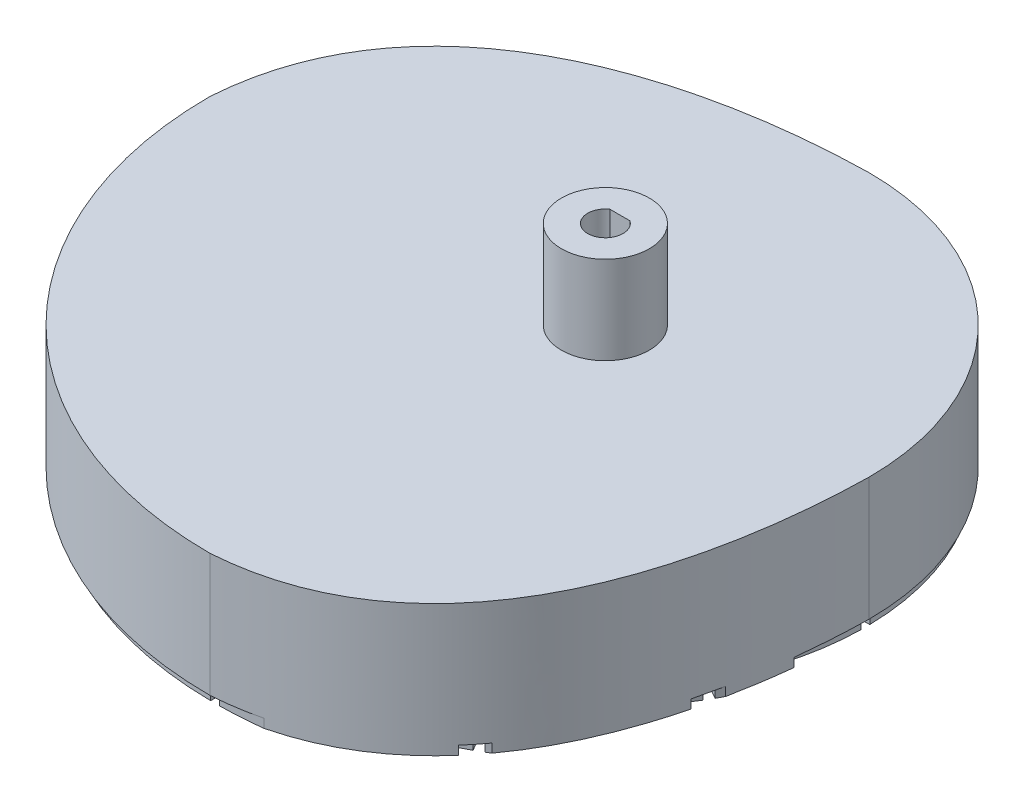
from build123d import *

# Parameters (mm, degrees)
BOSS_EXTRUDE1_DEPTH     = 19.05
SKETCH2_R               = 6.35
BOSS_EXTRUDE2_DEPTH     = 12.7
SKETCH3_R               = 2.55
CUT_EXTRUDE1_DEPTH      = 87.834944171
BOSS_EXTRUDE3_DEPTH     = 26.75
CUT_EXTRUDE_THIN1_START = -1.27
CUT_EXTRUDE_THIN1_DEPTH = 1.27


# Read off the part's stored shape, not the designer's step: Cut-Extrude-Thin1
with BuildPart() as part:
    # Sketch1 → Boss-Extrude1 (new body)
    with BuildSketch(Plane(origin=(0, 0, 0), x_dir=(1, 0, 0), z_dir=(0, 1, 0))):
        with BuildLine():
            ThreePointArc((-57.15, 0), (-40.411152545, -40.411152545), (0, -57.15))
            add(Edge.make_bspline(
                [(38.1, 0), (37.693518235, -23.557581484), (29.901985435, -55.10842187), (0, -57.15)],
                knots=[0, 0, 0, 0, 1, 1, 1, 1], degree=3))
            ThreePointArc((38.1, 0), (26.940768363, 26.940768363), (0, 38.1))
            add(Edge.make_bspline(
                [(0, 38.1), (-23.557581484, 37.693518235), (-55.10842187, 29.901985435), (-57.15, 0)],
                knots=[0, 0, 0, 0, 1, 1, 1, 1], degree=3))
        make_face()
    extrude(amount=BOSS_EXTRUDE1_DEPTH)

    # Sketch2 → Boss-Extrude2 (add)
    with BuildSketch(Plane(origin=(0, 19.05, 0), x_dir=(1, 0, 0), z_dir=(0, 1, 0))):
        with Locations(Location((0, 0, 0), (0, 0, 270))):
            Circle(SKETCH2_R)
    extrude(amount=BOSS_EXTRUDE2_DEPTH)

    # Sketch3 → Cut-Extrude1 (cut, through all)
    with BuildSketch(Plane(origin=(0, 31.75, 0), x_dir=(1, 0, 0), z_dir=(0, 1, 0))):
        with Locations(Location((0, 0, 0), (0, 0, 270))):
            Circle(SKETCH3_R)
    extrude(amount=-CUT_EXTRUDE1_DEPTH, mode=Mode.SUBTRACT)

    # Sketch4 → Boss-Extrude3 (add)
    with BuildSketch(Plane(origin=(0, 31.75, 0), x_dir=(1, 0, 0), z_dir=(0, 1, 0))):
        with BuildLine():
            Line((-1.446553711, 2.0999958), (1.446553711, 2.0999958))
            ThreePointArc((1.446553711, 2.0999958), (0, 2.55), (-1.446553711, 2.0999958))
        make_face()
    extrude(amount=-BOSS_EXTRUDE3_DEPTH)

    # Cut-Extrude-Thin1 outline → Cut-Extrude-Thin1 (cut)
    with BuildSketch(Plane.XZ.offset(CUT_EXTRUDE_THIN1_START)):
        with BuildLine():
            add(Edge.make_bspline(
                [(24.211964297, 45.42045397), (24.967134214, 44.556833389), (25.684798288, 43.657305675), (26.366501187, 42.725804771)],
                knots=[0.356391909, 0.356391909, 0.356391909, 0.356391909, 0.403553589, 0.403553589, 0.403553589, 0.403553589], degree=3))
            ThreePointArc((24.211964297, 45.42045397), (12.830623443, 49.822592097), (0.732561587, 51.41966412))
            Line((0.732561587, 51.41966412), (0.732561587, 56.500016495))
            ThreePointArc((0.732561587, 56.500016495), (3.763361973, 56.384569097), (6.78360426, 56.106692138))
            add(Edge.make_bspline(
                [(0, 57.15), (2.40124325, 56.986053505), (4.659902794, 56.631810592), (6.78360426, 56.106692138)],
                knots=[0, 0, 0, 0, 0.080303806, 0.080303806, 0.080303806, 0.080303806], degree=3))
            ThreePointArc((0, 57.15), (-40.411152545, 40.411152545), (-57.15, 0))
            add(Edge.make_bspline(
                [(-55.9165112, -7.519336787), (-56.546811344, -5.183507972), (-56.96698033, -2.680598612), (-57.15, 0)],
                knots=[0.910353825, 0.910353825, 0.910353825, 0.910353825, 1, 1, 1, 1], degree=3))
            ThreePointArc((-55.9165112, -7.519336787), (-56.270040753, -4.090463843), (-56.413870885, -0.646415977))
            Line((-56.413870885, -0.646415977), (-51.333518511, -0.646415977))
            ThreePointArc((-51.333518511, -0.646415977), (-49.694067342, -12.909203136), (-45.173828882, -24.425764832))
            add(Edge.make_bspline(
                [(-42.472456811, -26.550458134), (-43.405545738, -25.878239434), (-44.307297029, -25.170516398), (-45.173828882, -24.425764832)],
                knots=[0.592183935, 0.592183935, 0.592183935, 0.592183935, 0.639136321, 0.639136321, 0.639136321, 0.639136321], degree=3))
            ThreePointArc((-42.472456811, -26.550458134), (-42.751447986, -26.097611629), (-43.025622109, -25.641832534))
            Line((-43.025622109, -25.641832534), (-35.87589674, -21.513936667))
            ThreePointArc((-35.87589674, -21.513936667), (-29.991670039, -29.184798368), (-22.506298712, -35.303250721))
            add(Edge.make_bspline(
                [(-18.341150664, -36.227758843), (-19.735508874, -35.954107055), (-21.126004533, -35.646767343), (-22.506298712, -35.303250721)],
                knots=[0.246829945, 0.246829945, 0.246829945, 0.246829945, 0.302120611, 0.302120611, 0.302120611, 0.302120611], degree=3))
            ThreePointArc((-18.341150664, -36.227758843), (-19.008869632, -35.879980015), (-19.670031662, -35.519891827))
            Line((-19.670031662, -35.519891827), (-18.717409648, -33.869902099))
            ThreePointArc((-18.717409648, -33.869902099), (-14.235433235, -35.997044837), (-9.518335667, -37.53387252))
            add(Edge.make_bspline(
                [(0, -38.1), (-3.065002467, -38.047113942), (-6.265313138, -37.869215295), (-9.518335667, -37.53387252)],
                knots=[0, 0, 0, 0, 0.130106839, 0.130106839, 0.130106839, 0.130106839], degree=3))
            ThreePointArc((0, -38.1), (26.940768363, -26.940768363), (38.1, 0))
            add(Edge.make_bspline(
                [(37.46071201, 10.205981709), (37.843553204, 6.71649084), (38.04339156, 3.280732496), (38.1, 0)],
                knots=[0.860735598, 0.860735598, 0.860735598, 0.860735598, 1, 1, 1, 1], degree=3))
            ThreePointArc((37.46071201, 10.205981709), (35.966907075, 14.610152997), (33.956047708, 18.803555258))
            Line((33.956047708, 18.803555258), (35.606037436, 19.756177271))
            ThreePointArc((35.606037436, 19.756177271), (35.879395134, 19.256951573), (36.145734495, 18.753946529))
            add(Edge.make_bspline(
                [(35.212956342, 22.865584507), (35.558614799, 21.503497717), (35.868740428, 20.130913217), (36.145734495, 18.753946529)],
                knots=[0.69307893, 0.69307893, 0.69307893, 0.69307893, 0.747712266, 0.747712266, 0.747712266, 0.747712266], degree=3))
            ThreePointArc((35.212956342, 22.865584507), (29.153996147, 30.190764584), (21.600082277, 35.962042349))
            Line((21.600082277, 35.962042349), (25.727978144, 43.111767719))
            ThreePointArc((25.727978144, 43.111767719), (26.047957234, 42.919973364), (26.366501187, 42.725804771))
        make_face()
        with BuildLine():
            Line((-34.775914263, -20.878861488), (-33.125924535, -19.926239475))
            ThreePointArc((-33.125924535, -19.926239475), (-27.292219582, -27.401197146), (-19.817261911, -33.234902099))
            Line((-19.817261911, -33.234902099), (-20.769883924, -34.884891827))
            ThreePointArc((-20.769883924, -34.884891827), (-28.639258001, -28.748235565), (-34.775914263, -20.878861488))
        make_face(mode=Mode.SUBTRACT)
        with BuildLine():
            ThreePointArc((-43.660622109, -24.541980272), (-48.358107489, -12.995073375), (-50.063419265, -0.646415977))
            Line((-50.063419265, -0.646415977), (-41.807627531, -0.646415977))
            ThreePointArc((-41.807627531, -0.646415977), (-40.384389793, -10.858522157), (-36.51089674, -20.414084405))
            Line((-36.51089674, -20.414084405), (-43.660622109, -24.541980272))
        make_face(mode=Mode.SUBTRACT)
        with BuildLine():
            Line((-40.537477173, -0.646415977), (-38.632233145, -0.646415977))
            ThreePointArc((-38.632233145, -0.646415977), (-37.317575294, -10.036771689), (-33.760924535, -18.826387212))
            Line((-33.760924535, -18.826387212), (-35.410914263, -19.779009226))
            ThreePointArc((-35.410914263, -19.779009226), (-39.157663994, -10.52982197), (-40.537477173, -0.646415977))
        make_face(mode=Mode.SUBTRACT)
        with BuildLine():
            ThreePointArc((-32.66091944, -18.191298975), (-36.090849495, -9.708071502), (-37.362056671, -0.646415977))
            Line((-37.362056671, -0.646415977), (-2.4667076, -0.646415977))
            ThreePointArc((-2.4667076, -0.646415977), (-2.549972757, -0.011787303), (-2.472578202, 0.623584023))
            Line((-2.472578202, 0.623584023), (-37.362056671, 0.623584023))
            ThreePointArc((-37.362056671, 0.623584023), (-34.515585099, 14.325818816), (-26.83940131, 26.027521307))
            Line((-26.83940131, 26.027521307), (-2.162773151, 1.350893148))
            ThreePointArc((-2.162773151, 1.350893148), (-1.758099022, 1.84704841), (-1.242590656, 2.226761878))
            Line((-1.242590656, 2.226761878), (-25.941375698, 26.925546919))
            ThreePointArc((-25.941375698, 26.925546919), (-14.239673207, 34.601730708), (-0.537438413, 37.44820228))
            Line((-0.537438413, 37.44820228), (-0.537438413, 2.492721395))
            ThreePointArc((-0.537438413, 2.492721395), (0.100740098, 2.548009308), (0.732561587, 2.442509677))
            Line((0.732561587, 2.442509677), (0.732561587, 37.44820228))
            ThreePointArc((0.732561587, 37.44820228), (9.794217112, 36.176995105), (18.277444584, 32.74706505))
            Line((18.277444584, 32.74706505), (0.773749606, 2.429776028))
            ThreePointArc((0.773749606, 2.429776028), (1.354808059, 2.160322921), (1.85039351, 1.754577971))
            Line((1.85039351, 1.754577971), (19.377296847, 32.11206505))
            ThreePointArc((19.377296847, 32.11206505), (26.589317144, 26.48033958), (32.221042614, 19.268319283))
            Line((32.221042614, 19.268319283), (1.863055518, 1.741127261))
            ThreePointArc((1.863055518, 1.741127261), (2.238029909, 1.222179252), (2.471920537, 0.62618596))
            Line((2.471920537, 0.62618596), (32.856042614, 18.16846702))
            ThreePointArc((32.856042614, 18.16846702), (36.285972669, 9.685239548), (37.557179844, 0.623584023))
            Line((37.557179844, 0.623584023), (2.472578202, 0.623584023))
            ThreePointArc((2.472578202, 0.623584023), (2.549972757, -0.011787303), (2.4667076, -0.646415977))
            Line((2.4667076, -0.646415977), (37.557179844, -0.646415977))
            ThreePointArc((37.557179844, -0.646415977), (34.710708272, -14.348650771), (27.034524483, -26.050353262))
            Line((27.034524483, -26.050353262), (2.226761878, -1.242590656))
            ThreePointArc((2.226761878, -1.242590656), (1.84704841, -1.758099022), (1.350893148, -2.162773151))
            Line((1.350893148, -2.162773151), (26.136498871, -26.948378874))
            ThreePointArc((26.136498871, -26.948378874), (14.43479638, -34.624562663), (0.732561587, -37.471034235))
            Line((0.732561587, -37.471034235), (0.732561587, -2.442509677))
            ThreePointArc((0.732561587, -2.442509677), (0.100740098, -2.548009308), (-0.537438413, -2.492721395))
            Line((-0.537438413, -2.492721395), (-0.537438413, -37.471034235))
            ThreePointArc((-0.537438413, -37.471034235), (-9.599093938, -36.199827059), (-18.082321411, -32.769897004))
            Line((-18.082321411, -32.769897004), (-0.594312341, -2.479776772))
            ThreePointArc((-0.594312341, -2.479776772), (-1.1934905, -2.253459657), (-1.717372963, -1.884974829))
            Line((-1.717372963, -1.884974829), (-19.182173673, -32.134897004))
            ThreePointArc((-19.182173673, -32.134897004), (-26.39419397, -26.503171534), (-32.02591944, -19.291151237))
            Line((-32.02591944, -19.291151237), (-1.778253218, -1.827653001))
            ThreePointArc((-1.778253218, -1.827653001), (-2.177453235, -1.327101129), (-2.439388198, -0.742889776))
            Line((-2.439388198, -0.742889776), (-32.66091944, -18.191298975))
        make_face(mode=Mode.SUBTRACT)
        with BuildLine():
            Line((-40.311068335, 39.499188332), (-36.71871672, 35.906836718))
            ThreePointArc((-36.71871672, 35.906836718), (-47.422182168, 19.671906367), (-51.333518511, 0.623584023))
            Line((-51.333518511, 0.623584023), (-56.413870885, 0.623584023))
            ThreePointArc((-56.413870885, 0.623584023), (-52.115490193, 21.615938203), (-40.311068335, 39.499188332))
        make_face(mode=Mode.SUBTRACT)
        with BuildLine():
            Line((-29.08476268, 28.272882678), (-27.737551708, 26.925671706))
            ThreePointArc((-27.737551708, 26.925671706), (-35.688912105, 14.811826776), (-38.632233145, 0.623584023))
            Line((-38.632233145, 0.623584023), (-40.537477173, 0.623584023))
            ThreePointArc((-40.537477173, 0.623584023), (-37.448902614, 15.540838714), (-29.08476268, 28.272882678))
        make_face(mode=Mode.SUBTRACT)
        with BuildLine():
            ThreePointArc((-50.063419265, 0.623584023), (-46.248855162, 19.185898408), (-35.82062093, 35.008740928))
            Line((-35.82062093, 35.008740928), (-29.982894611, 29.171014609))
            ThreePointArc((-29.982894611, 29.171014609), (-38.622229621, 16.026846674), (-41.807627531, 0.623584023))
            Line((-41.807627531, 0.623584023), (-50.063419265, 0.623584023))
        make_face(mode=Mode.SUBTRACT)
        with BuildLine():
            Line((-0.537438413, 40.623622783), (-0.537438413, 38.718378755))
            ThreePointArc((-0.537438413, 38.718378755), (-14.725681166, 35.775057715), (-26.839526096, 27.823697318))
            Line((-26.839526096, 27.823697318), (-28.186737068, 29.17090829))
            ThreePointArc((-28.186737068, 29.17090829), (-15.454693104, 37.535048224), (-0.537438413, 40.623622783))
        make_face(mode=Mode.SUBTRACT)
        with BuildLine():
            ThreePointArc((-34.922595318, 35.90676654), (-19.099752798, 46.335000771), (-0.537438413, 50.149564874))
            Line((-0.537438413, 50.149564874), (-0.537438413, 41.893773141))
            ThreePointArc((-0.537438413, 41.893773141), (-15.940701063, 38.70837523), (-29.084868999, 30.069040221))
            Line((-29.084868999, 30.069040221), (-34.922595318, 35.90676654))
        make_face(mode=Mode.SUBTRACT)
        with BuildLine():
            Line((-0.537438413, 56.500016495), (-0.537438413, 51.41966412))
            ThreePointArc((-0.537438413, 51.41966412), (-19.585760757, 47.508327778), (-35.820691108, 36.80486233))
            Line((-35.820691108, 36.80486233), (-39.413042722, 40.397213944))
            ThreePointArc((-39.413042722, 40.397213944), (-21.529792593, 52.201635803), (-0.537438413, 56.500016495))
        make_face(mode=Mode.SUBTRACT)
        with BuildLine():
            Line((34.971037436, 20.856029534), (33.321047708, 19.90340752))
            ThreePointArc((33.321047708, 19.90340752), (27.487342756, 27.378365192), (20.012385084, 33.212070144))
            Line((20.012385084, 33.212070144), (20.965007098, 34.862059872))
            ThreePointArc((20.965007098, 34.862059872), (28.834381174, 28.72540361), (34.971037436, 20.856029534))
        make_face(mode=Mode.SUBTRACT)
        with BuildLine():
            Line((19.865154835, 35.497059872), (18.912532822, 33.847070144))
            ThreePointArc((18.912532822, 33.847070144), (10.122917299, 37.403720904), (0.732561587, 38.718378755))
            Line((0.732561587, 38.718378755), (0.732561587, 40.623622783))
            ThreePointArc((0.732561587, 40.623622783), (10.61596758, 39.243809603), (19.865154835, 35.497059872))
        make_face(mode=Mode.SUBTRACT)
        with BuildLine():
            ThreePointArc((0.732561587, 50.149564874), (13.081218984, 48.444253099), (24.628125881, 43.746767719))
            Line((24.628125881, 43.746767719), (20.500230014, 36.597042349))
            ThreePointArc((20.500230014, 36.597042349), (10.944667767, 40.470535403), (0.732561587, 41.893773141))
            Line((0.732561587, 41.893773141), (0.732561587, 50.149564874))
        make_face(mode=Mode.SUBTRACT)
    extrude(amount=CUT_EXTRUDE_THIN1_DEPTH, mode=Mode.SUBTRACT)


solid = part.part
